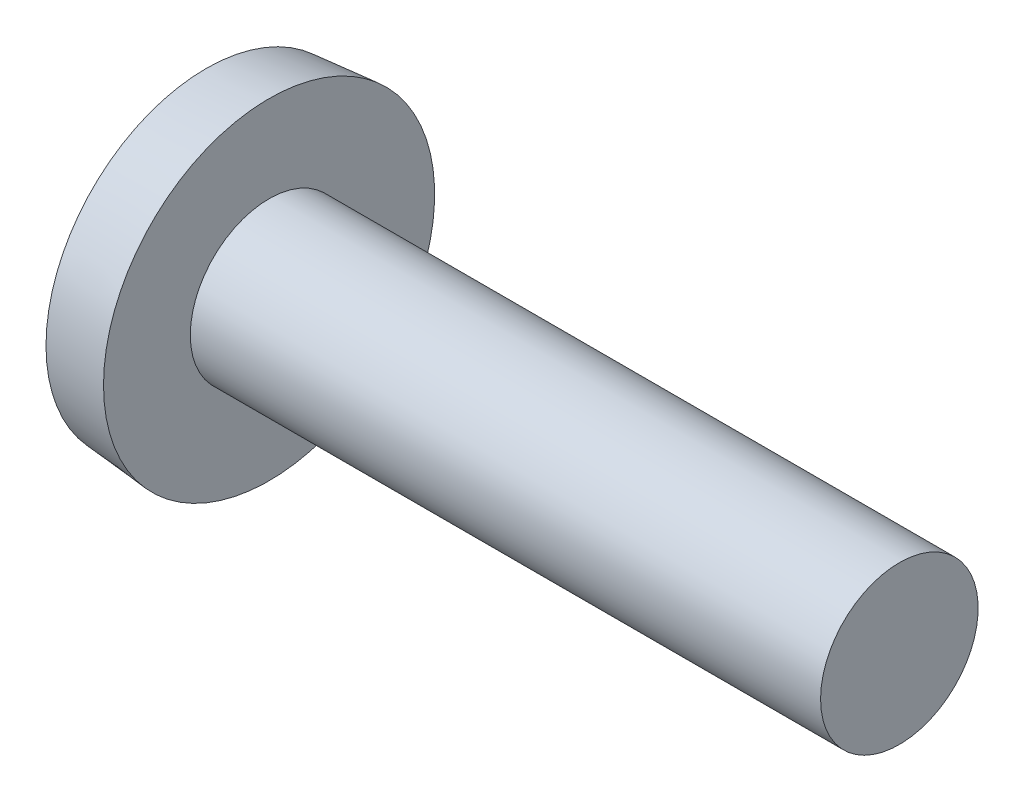
from build123d import *

# Parameters (mm, degrees)
SKETCH2_W         = 20.0152
SKETCH2_H         = 1.7018
SLOT_DEPTH        = 2.2606
CIRPATTERN1_COUNT = 2
CIRPATTERN1_ANGLE = 90


with BuildPart() as part:
    # BodySke → Base-Revolve (revolve)
    with BuildSketch(Plane.XY):
        with BuildLine():
            Line((6.1976, 4.7625), (6.1976, 10.0076))
            Line((6.1976, 10.0076), (2.3876, 9.674268192))
            ThreePointArc((2.3876, 9.674268192), (0.605722555, 4.982271039), (0, 0))
            Line((0, 0), (44.2976, 0))
            Line((44.2976, 0), (44.2976, 4.7625))
            Line((44.2976, 4.7625), (6.1976, 4.7625))
        make_face()
    revolve(axis=Axis((-25.4, 0, 0), (1, 0, 0)))

    # Sketch2 → Slot (cut)
    with BuildSketch(Plane(origin=(0, 0, 0), x_dir=(0, 0, -1), z_dir=(1, 0, 0))):
        Rectangle(SKETCH2_W, SKETCH2_H)
    extrude(amount=SLOT_DEPTH, mode=Mode.SUBTRACT)

    # Sketch3 → Cross section 0
    with BuildSketch(Plane(origin=(0, 0, 0), x_dir=(0, 0, -1), z_dir=(1, 0, 0))):
        with BuildLine():
            Line((-1.0287, 6.096), (1.0287, 6.096))
            Line((1.0287, 6.096), (1.0287, -6.096))
            Line((1.0287, -6.096), (-1.0287, -6.096))
            Line((-1.0287, -6.096), (-1.0287, 6.096))
        make_face()
    # Sketch4 → Cross section 1
    with BuildSketch(Plane(origin=(4.3434, 0, 0), x_dir=(0, 0, -1), z_dir=(1, 0, 0))):
        with BuildLine():
            Line((-0.51435, 0.51435), (0.51435, 0.51435))
            Line((0.51435, 0.51435), (0.51435, -0.51435))
            Line((0.51435, -0.51435), (-0.51435, -0.51435))
            Line((-0.51435, -0.51435), (-0.51435, 0.51435))
        make_face()
    cross = loft(mode=Mode.SUBTRACT)

    # CirPattern1: Cross ×2 about axis
    cirpattern1_axis = Axis((-25.4, 0, 0), (1, 0, 0))
    for i in range(1, CIRPATTERN1_COUNT):
        add(cross.rotate(cirpattern1_axis, i * CIRPATTERN1_ANGLE / (CIRPATTERN1_COUNT - 1)), mode=Mode.SUBTRACT)


solid = part.part
